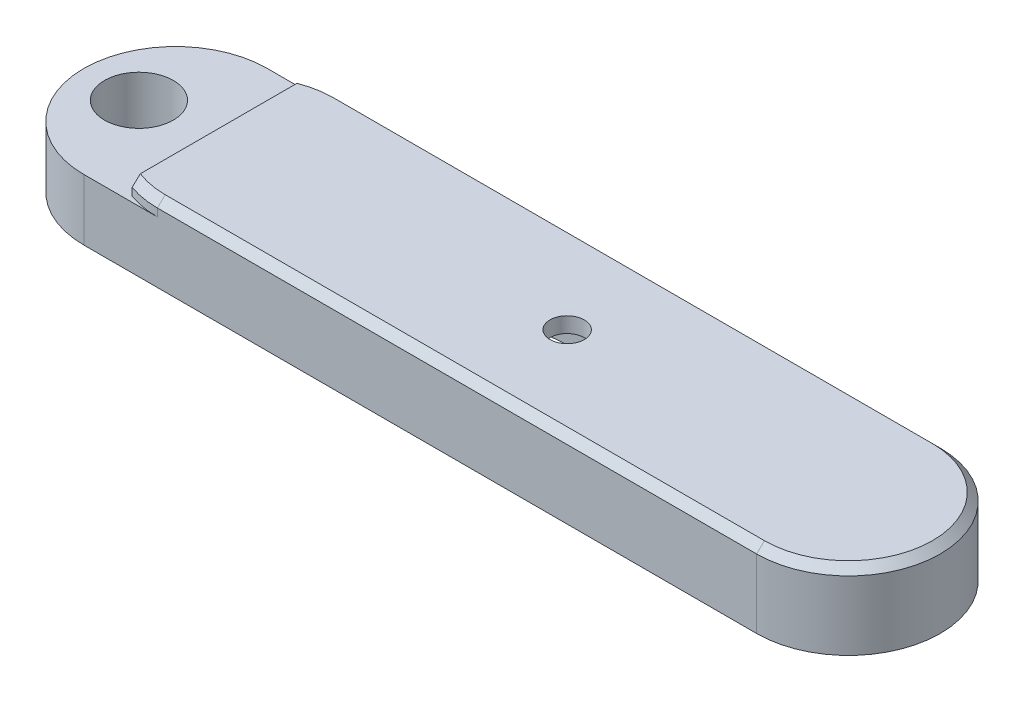
from build123d import *

# Parameters (mm, degrees)
BOSS_EXTRUDE1_DEPTH             = 1.6
SKETCH2_R                       = 3.58
BOSS_EXTRUDE2_DEPTH             = 1.83
F_1_0_1_DIAMETER_HOLE1_D        = 1
BOSS_EXTRUDE3_DEPTH             = 3.175
CUT_EXTRUDE1_DEPTH              = 3.175
SKETCH8_R                       = 3.58
CUT_EXTRUDE2_DEPTH              = 3.175
BOSS_EXTRUDE4_DEPTH             = 0.8
CUT_EXTRUDE3_DEPTH              = 28.603685216
CUT_EXTRUDE3_DEPTH_BACK         = 28.603685216
SKETCH10_R                      = 0.889
CHAMFER2_SIZE                   = 0.4
F_9_64_0_14063_DIAMETER_HOLE1_D = 3.572002


with BuildPart() as part:
    # Sketch1 → Boss-Extrude1 (new body)
    with BuildSketch(Plane(origin=(0, 14.27, 0), x_dir=(1, 0, 0), z_dir=(0, 1, 0))):
        with BuildLine():
            Line((8.033254556, 3.025), (20.046175024, 3.905348937))
            ThreePointArc((20.046175024, 3.905348937), (21.9, 5.9), (20.046175024, 7.894651063))
            Line((20.046175024, 7.894651063), (8.033254556, 8.775))
            ThreePointArc((8.033254556, 8.775), (5.9, 9.48), (3.766745444, 8.775))
            Line((3.766745444, 8.775), (-8.246175024, 7.894651063))
            ThreePointArc((-8.246175024, 7.894651063), (-10.1, 5.9), (-8.246175024, 3.905348937))
            Line((-8.246175024, 3.905348937), (3.766745444, 3.025))
            ThreePointArc((3.766745444, 3.025), (5.9, 2.32), (8.033254556, 3.025))
        make_face()
    extrude(amount=-BOSS_EXTRUDE1_DEPTH)

    # Sketch2 → Boss-Extrude2 (add)
    with BuildSketch(Plane.XZ.offset(-12.67)):
        with Locations((5.9, -5.9)):
            Circle(SKETCH2_R)
    extrude(amount=BOSS_EXTRUDE2_DEPTH)

    # Ø1.0 (1) Diameter Hole1 (through all)
    with Locations(Plane(origin=(0, 12.67, 0), x_dir=(-1, 0, 0), z_dir=(0, -1, 0))):
        with Locations((2.7, 5.9), (6.7, 5.9), (8.7, 5.9), (4.7, 5.9), (0.7, 5.9), (-10.5, 5.9), (-14.5, 5.9), (-18.5, 5.9), (-20.5, 5.9), (-16.5, 5.9), (-12.5, 5.9), (-1.3, 5.9)):
            Hole(F_1_0_1_DIAMETER_HOLE1_D / 2)

    # Sketch7 → Cut-Extrude1 (cut)
    with BuildSketch(Plane(origin=(0, 14.27, 0), x_dir=(1, 0, 0), z_dir=(0, 1, 0))):
        with BuildLine():
            Line((8.033254556, 3.025), (20.046175024, 3.905348937))
            ThreePointArc((20.046175024, 3.905348937), (21.9, 5.9), (20.046175024, 7.894651063))
            Line((20.046175024, 7.894651063), (8.033254556, 8.775))
            ThreePointArc((8.033254556, 8.775), (5.9, 9.48), (3.766745444, 8.775))
            Line((3.766745444, 8.775), (-8.246175024, 7.894651063))
            ThreePointArc((-8.246175024, 7.894651063), (-10.1, 5.9), (-8.246175024, 3.905348937))
            Line((-8.246175024, 3.905348937), (3.766745444, 3.025))
            ThreePointArc((3.766745444, 3.025), (5.9, 2.32), (8.033254556, 3.025))
        make_face()
    extrude(amount=-CUT_EXTRUDE1_DEPTH, mode=Mode.SUBTRACT)

    # Sketch8 → Cut-Extrude2 (cut)
    with BuildSketch(Plane(origin=(0, 11.095, 0), x_dir=(1, 0, 0), z_dir=(0, 1, 0))):
        with Locations((5.9, 5.9)):
            Circle(SKETCH8_R)
    extrude(amount=-CUT_EXTRUDE2_DEPTH, mode=Mode.SUBTRACT)


with BuildPart() as body_2:
    # Sketch6 → Boss-Extrude3 (new body)
    with BuildSketch(Plane(origin=(0, 14.27, 0), x_dir=(1, 0, 0), z_dir=(0, 1, 0))):
        with BuildLine():
            Line((-14.425, 1.1375), (20.5, 1.1375))
            ThreePointArc((20.5, 1.1375), (25.2625, 5.9), (20.5, 10.6625))
            Line((20.5, 10.6625), (-14.425, 10.6625))
            ThreePointArc((-14.425, 10.6625), (-19.1875, 5.9), (-14.425, 1.1375))
        make_face()
        with BuildLine():
            Line((3.590504254, 9.263425248), (-8.282718781, 8.393313828))
            ThreePointArc((-8.282718781, 8.393313828), (-10.6, 5.9), (-8.282718781, 3.406686172))
            Line((-8.282718781, 3.406686172), (3.590504254, 2.536574752))
            ThreePointArc((3.590504254, 2.536574752), (5.9, 1.82), (8.209495746, 2.536574752))
            Line((8.209495746, 2.536574752), (20.082718781, 3.406686172))
            ThreePointArc((20.082718781, 3.406686172), (22.4, 5.9), (20.082718781, 8.393313828))
            Line((20.082718781, 8.393313828), (8.209495746, 9.263425248))
            ThreePointArc((8.209495746, 9.263425248), (5.9, 9.98), (3.590504254, 9.263425248))
        make_face(mode=Mode.SUBTRACT)
    extrude(amount=-BOSS_EXTRUDE3_DEPTH)

    # Sketch9 → Boss-Extrude4 (add)
    with BuildSketch(Plane(origin=(0, 14.27, 0), x_dir=(1, 0, 0), z_dir=(0, 1, 0))):
        with BuildLine():
            Line((20.5, 1.1375), (-10.6, 1.1375))
            ThreePointArc((-10.6, 1.1375), (-11.405348174, 1.20608686), (-12.1875, 1.409871939))
            Line((-12.1875, 1.409871939), (-12.1875, 10.390128061))
            ThreePointArc((-12.1875, 10.390128061), (-11.405348174, 10.59391314), (-10.6, 10.6625))
            Line((-10.6, 10.6625), (20.5, 10.6625))
            ThreePointArc((20.5, 10.6625), (25.2625, 5.9), (20.5, 1.1375))
        make_face()
    extrude(amount=BOSS_EXTRUDE4_DEPTH)

    # Sketch10 → Cut-Extrude3 (cut, two sides: drawn at the far end of the back side and taken through both)
    with BuildSketch(Plane(origin=(0, 14.27, 0), x_dir=(1, 0, 0), z_dir=(0, 1, 0)).offset(-CUT_EXTRUDE3_DEPTH_BACK)):
        with Locations((5.9, 5.9)):
            Circle(SKETCH10_R)
    extrude(amount=CUT_EXTRUDE3_DEPTH + CUT_EXTRUDE3_DEPTH_BACK, mode=Mode.SUBTRACT)

    # Chamfer2
    chamfer2_edges = [body_2.edges().sort_by_distance(p)[0] for p in [
        (4.95, 15.07, -10.6625),
        (25.2625, 15.07, -5.9),
        (4.95, 15.07, -1.1375),
        (-11.405348174, 15.07, -10.59391314),
        (-11.405348174, 15.07, -1.20608686),
    ]]
    chamfer(chamfer2_edges, length=CHAMFER2_SIZE)

    # 9/64 (0.14063) Diameter Hole1 (through all)
    with Locations(Plane(origin=(0, 14.27, 0), x_dir=(1, 0, 0), z_dir=(0, 1, 0))):
        with Locations((-16.325, 5.9)):
            Hole(F_9_64_0_14063_DIAMETER_HOLE1_D / 2)


solid = body_2.part
